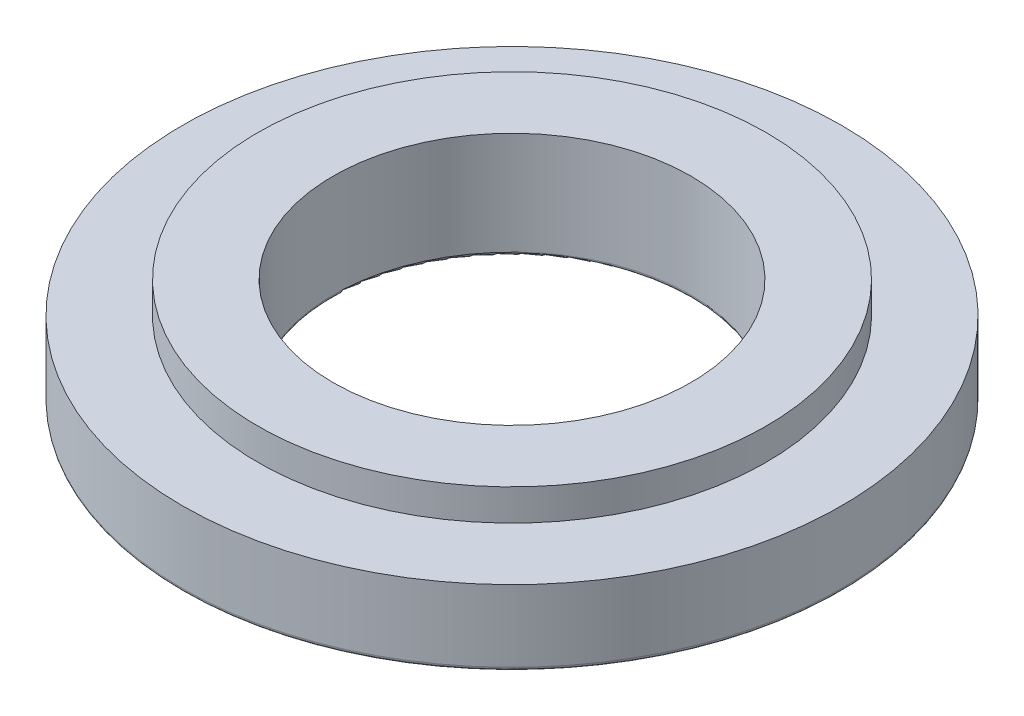
from build123d import *

# Parameters (mm, degrees)
FILLET1_R = 0.15


with BuildPart() as part:
    # Sketch1 → Revolve1 (revolve)
    with BuildSketch(Plane.XY):
        Polygon((7.125, 0), (7.125, 4.25), (10.125, 4.25), (10.125, 3), (13.125, 3), (13.125, 0), align=None)
    revolve(axis=Axis((0, 0, 0), (0, 1, 0)))

    # Fillet1
    fillet1_edges = [part.edges().sort_by_distance(p)[0] for p in [
        (-7.125, 0, 0),
        (-13.125, 0, 0),
    ]]
    fillet(fillet1_edges, radius=FILLET1_R)


solid = part.part
